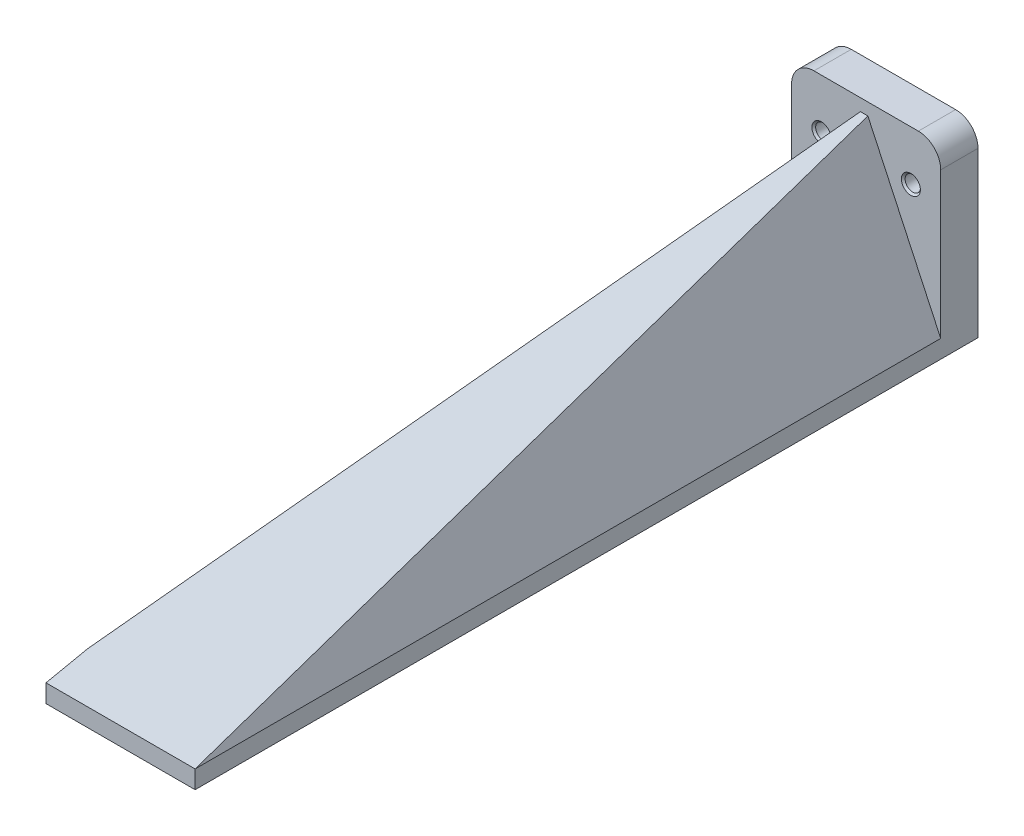
from build123d import *

# Parameters (mm, degrees)
SKETCH1_W                          = 20
SKETCH1_H                          = 25
BOSS_EXTRUDE1_DEPTH                = 5
BOSS_EXTRUDE3_DEPTH                = 100
CUT_EXTRUDE2_DEPTH                 = 110.772492001
FILLET1_R                          = 3
SHELL1_START                       = 2.5
SHELL1_DEPTH                       = 13.421878312
SHELL1_START_2                     = 15.921878312
SHELL1_2_DEPTH                     = 86.578121688
SHELL1_START_3                     = 21.404196581
SHELL1_3_DEPTH                     = 2.5
M2_5X0_45_TAPPED_HOLE2_D           = 2.05
M2_5X0_45_TAPPED_HOLE2_CSINK_D     = 2.55
M2_5X0_45_TAPPED_HOLE2_CSINK_ANGLE = 90


with BuildPart() as part:
    # Sketch1 → Boss-Extrude1 (new body)
    with BuildSketch(Plane.XY):
        with Locations((10, 12.5)):
            Rectangle(SKETCH1_W, SKETCH1_H)
    extrude(amount=BOSS_EXTRUDE1_DEPTH)

    # Sketch2 → Boss-Extrude3 (add)
    with BuildSketch(Plane.XY.offset(5)):
        Polygon((0, 0), (0, 3.587380473), (9.227415524, 23.375636922), (10.227415524, 23.375636922), (20, 2.418261881), (20, 0), align=None)
    extrude(amount=BOSS_EXTRUDE3_DEPTH)

    # Sketch3 → Cut-Extrude2 (cut, through all)
    with BuildSketch(Plane(origin=(20, 0, 0), x_dir=(0, 0, -1), z_dir=(1, 0, 0))):
        Polygon((-105, 2.418261881), (-5, 23.375636922), (-105, 23.375636922), align=None)
    extrude(amount=-CUT_EXTRUDE2_DEPTH, mode=Mode.SUBTRACT)

    # Fillet1
    fillet1_edges = [part.edges().sort_by_distance(p)[0] for p in [
        (0, 25, 2.5),
        (20, 25, 2.5),
    ]]
    fillet(fillet1_edges, radius=FILLET1_R)

    # Shell1: read off the stored shape, not the designer's step
    # Shell1 outline → Shell1 (cut)
    with BuildSketch(Plane.XY.offset(SHELL1_START)):
        Polygon((2.5, 3.033143816), (2.5, 0), (17.5, 0), (17.5, 1.864025225), (9.727415524, 18.532386424), align=None)
    extrude(amount=SHELL1_DEPTH, mode=Mode.SUBTRACT)

    # Shell1 2 outline → Shell1 2 (cut)
    with BuildSketch(Plane.XY.offset(SHELL1_START_2)):
        Polygon((2.5, 3.033143816), (2.5, 0), (17.5, 0), (17.5, 1.864025225), (9.727415524, 18.532386424), align=None)
    extrude(amount=SHELL1_2_DEPTH, mode=Mode.SUBTRACT)

    # Shell1 3 outline → Shell1 3 (add)
    with BuildSketch(Plane(origin=(0, 0, 0), x_dir=(1, 0, 0), z_dir=(0, 0.9787373237991824, 0.2051176516110071)).offset(SHELL1_START_3)):
        Polygon((17.5, -93.044458657), (9.727415524, -11.782016987), (2.5, -87.344712281), (2.5, -100.241013679), (17.5, -100.241013679), align=None)
    extrude(amount=SHELL1_3_DEPTH)

    # M2.5x0.45 Tapped Hole2 (through all)
    with Locations(Plane.XY.offset(5)):
        with Locations((16, 18.307180682), (4, 18.307180682)):
            CounterSinkHole(M2_5X0_45_TAPPED_HOLE2_D / 2, M2_5X0_45_TAPPED_HOLE2_CSINK_D / 2, counter_sink_angle=M2_5X0_45_TAPPED_HOLE2_CSINK_ANGLE)


solid = part.part
